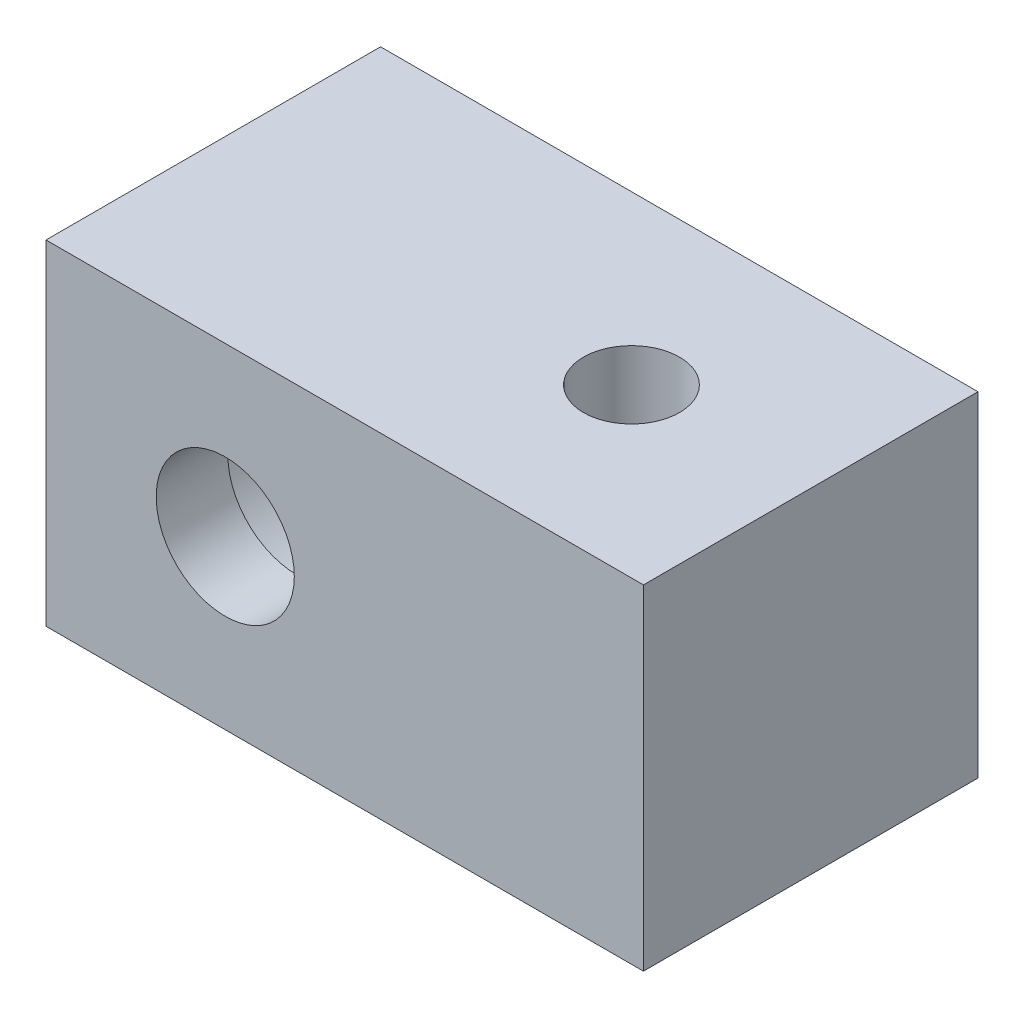
from build123d import *

# Parameters (mm, degrees)
SKETCH1_W               = 31.75
SKETCH1_H               = 17.78
BOSS_EXTRUDE1_DEPTH     = 17.78
SKETCH3_R               = 6.4389
CUT_EXTRUDE1_DEPTH      = 13.97
CUT_EXTRUDE2_REACH      = 31.737
SKETCH2_R               = 3.6703
F_1_4_20_TAPPED_HOLE1_D = 5.1054


with BuildPart() as part:
    # Sketch1 → Boss-Extrude1 (new body)
    with BuildSketch(Plane(origin=(0, 0, 0), x_dir=(1, 0, 0), z_dir=(0, 1, 0))):
        Rectangle(SKETCH1_W, SKETCH1_H)
    extrude(amount=BOSS_EXTRUDE1_DEPTH)

    # Sketch3 → Cut-Extrude1 (cut)
    with BuildSketch(Plane(origin=(0, 0, -8.89), x_dir=(-1, 0, 0), z_dir=(0, 0, -1))):
        with Locations((6.35, 8.89)):
            Circle(SKETCH3_R)
    extrude(amount=-CUT_EXTRUDE1_DEPTH, mode=Mode.SUBTRACT)

    # Sketch2 → Cut-Extrude2 (cut, up to next)
    with BuildSketch(Plane.XY.offset(8.89), mode=Mode.PRIVATE) as cut_extrude2_sk1:
        with Locations((-6.35, 8.89)):
            Circle(SKETCH2_R)
    cut_extrude2_tool1 = extrude(cut_extrude2_sk1.sketch, amount=-CUT_EXTRUDE2_REACH, mode=Mode.PRIVATE) & part.part
    add(cut_extrude2_tool1.solids().sort_by_distance((-6.35, 8.89, 8.89))[0], mode=Mode.SUBTRACT)

    # 1/4-20 Tapped Hole1 (through all)
    with Locations(Plane(origin=(0, 17.78, 0), x_dir=(1, 0, 0), z_dir=(0, 1, 0))):
        with Locations((6.35, 0)):
            Hole(F_1_4_20_TAPPED_HOLE1_D / 2)


solid = part.part
